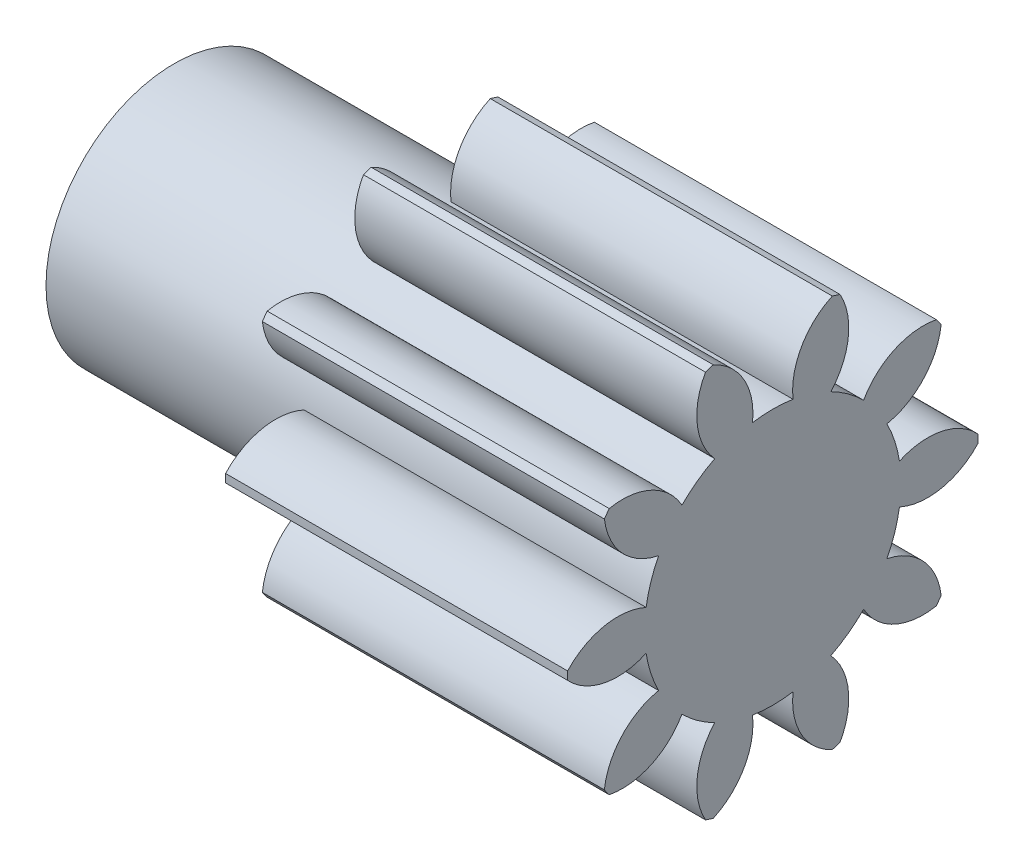
from build123d import *
from build123d.topology import SkipClean

# Parameters (mm, degrees)
ISO_START                                 = 20.256289073
ISO_SPUR_GEAR_0_8M_10T_20PA_8FW_2_R       = 0.4
ISO_SPUR_GEAR_0_8M_10T_20PA_8FW_S10_DEPTH = 8
BOSS_EXTRUDE1_DEPTH                       = 6
BOSS_EXTRUDE1_DEPTH_BACK                  = 8
SKETCH1_R                                 = 2.999
SKETCH2_R                                 = 2.4
CUT_EXTRUDE1_DEPTH                        = 3.2


# Read off the part's stored shape, not the designer's step: ISO - Spur gear 0.8M 10T 20PA 8FW ---S10A75H50L0.8N
with BuildPart() as part:
    # ISO - Spur gear 0.8M 10T 20PA 8FW -- 2 → ISO - Spur gear 0.8M 10T 20PA 8FW ---S10 (new body)
    with BuildSketch(Plane.YZ.offset(ISO_START)):
        with BuildLine():
            ThreePointArc((-8.829245422, -9.554744908), (-8.733282752, -9.555704257), (-8.637320082, -9.554744908))
            ThreePointArc((-8.637320082, -9.554744908), (-8.156276182, -8.696191622), (-8.268716011, -7.718503397))
            ThreePointArc((-8.268716011, -7.718503397), (-7.806540786, -7.60792275), (-7.367635501, -7.425724592))
            ThreePointArc((-7.367635501, -7.425724592), (-6.883930514, -8.282781454), (-5.990112863, -8.694615143))
            ThreePointArc((-5.990112863, -8.694615143), (-5.911913541, -8.63898583), (-5.834842001, -8.581804258))
            ThreePointArc((-5.834842001, -8.581804258), (-5.950314271, -7.604469549), (-6.615950723, -6.879593633))
            ThreePointArc((-6.615950723, -6.879593633), (-6.307040786, -6.518472229), (-6.059052342, -6.113088769))
            ThreePointArc((-6.059052342, -6.113088769), (-5.163961403, -6.522147678), (-4.198777965, -6.329955298))
            ThreePointArc((-4.198777965, -6.329955298), (-4.168211474, -6.23898583), (-4.139469773, -6.147423452))
            ThreePointArc((-4.139469773, -6.147423452), (-4.807351731, -5.42461596), (-5.771934306, -5.229430316))
            ThreePointArc((-5.771934306, -5.229430316), (-5.734282752, -4.755704258), (-5.771934306, -4.281978199))
            ThreePointArc((-5.771934306, -4.281978199), (-4.807351731, -4.086792554), (-4.139469773, -3.363985063))
            ThreePointArc((-4.139469773, -3.363985063), (-4.168211474, -3.272422685), (-4.198777965, -3.181453217))
            ThreePointArc((-4.198777965, -3.181453217), (-5.163961403, -2.989260837), (-6.059052342, -3.398319746))
            ThreePointArc((-6.059052342, -3.398319746), (-6.307040786, -2.992936286), (-6.615950723, -2.631814882))
            ThreePointArc((-6.615950723, -2.631814882), (-5.950314271, -1.906938966), (-5.834842001, -0.929604257))
            ThreePointArc((-5.834842001, -0.929604257), (-5.91191354, -0.872422684), (-5.990112863, -0.816793372))
            ThreePointArc((-5.990112863, -0.816793372), (-6.883930514, -1.228627061), (-7.367635501, -2.085683923))
            ThreePointArc((-7.367635501, -2.085683923), (-7.806540786, -1.903485765), (-8.268716011, -1.792905118))
            ThreePointArc((-8.268716011, -1.792905118), (-8.156276182, -0.815216893), (-8.637320082, 0.043336393))
            ThreePointArc((-8.637320082, 0.043336393), (-8.733282752, 0.044295743), (-8.829245422, 0.043336393))
            ThreePointArc((-8.829245422, 0.043336393), (-9.310289322, -0.815216893), (-9.197849493, -1.792905118))
            ThreePointArc((-9.197849493, -1.792905118), (-9.660024718, -1.903485765), (-10.098930003, -2.085683923))
            ThreePointArc((-10.098930003, -2.085683923), (-10.58263499, -1.228627061), (-11.476452641, -0.816793372))
            ThreePointArc((-11.476452641, -0.816793372), (-11.554651964, -0.872422684), (-11.631723503, -0.929604257))
            ThreePointArc((-11.631723503, -0.929604257), (-11.516251233, -1.906938966), (-10.850614781, -2.631814882))
            ThreePointArc((-10.850614781, -2.631814882), (-11.159524718, -2.992936286), (-11.407513162, -3.398319746))
            ThreePointArc((-11.407513162, -3.398319746), (-12.302604101, -2.989260837), (-13.267787539, -3.181453217))
            ThreePointArc((-13.267787539, -3.181453217), (-13.29835403, -3.272422685), (-13.327095731, -3.363985063))
            ThreePointArc((-13.327095731, -3.363985063), (-12.659213773, -4.086792554), (-11.694631199, -4.281978199))
            ThreePointArc((-11.694631199, -4.281978199), (-11.732282752, -4.755704258), (-11.694631199, -5.229430316))
            ThreePointArc((-11.694631199, -5.229430316), (-12.659213774, -5.42461596), (-13.327095731, -6.147423452))
            ThreePointArc((-13.327095731, -6.147423452), (-13.29835403, -6.23898583), (-13.267787539, -6.329955298))
            ThreePointArc((-13.267787539, -6.329955298), (-12.302604101, -6.522147678), (-11.407513162, -6.113088769))
            ThreePointArc((-11.407513162, -6.113088769), (-11.159524718, -6.518472229), (-10.850614781, -6.879593633))
            ThreePointArc((-10.850614781, -6.879593633), (-11.516251233, -7.604469549), (-11.631723503, -8.581804258))
            ThreePointArc((-11.631723503, -8.581804258), (-11.554651963, -8.63898583), (-11.476452641, -8.694615143))
            ThreePointArc((-11.476452641, -8.694615143), (-10.58263499, -8.282781454), (-10.098930003, -7.425724592))
            ThreePointArc((-10.098930003, -7.425724592), (-9.660024718, -7.60792275), (-9.197849493, -7.718503397))
            ThreePointArc((-9.197849493, -7.718503397), (-9.310289322, -8.696191622), (-8.829245422, -9.554744908))
        make_face()
        with Locations((-8.733282752, -4.755704257)):
            Circle(ISO_SPUR_GEAR_0_8M_10T_20PA_8FW_2_R, mode=Mode.SUBTRACT)
    extrude(amount=ISO_SPUR_GEAR_0_8M_10T_20PA_8FW_S10_DEPTH)

    # Sketch1 → Boss-Extrude1 (add, two sides: drawn at the far end of the back side and taken through both)
    with SkipClean():  # the faces are left unmerged after this step: merging them gives an invalid solid
        with BuildSketch(Plane.ZY.offset(-20.256289073).offset(-BOSS_EXTRUDE1_DEPTH_BACK)):
            with Locations((-4.755704257, -8.733282752)):
                Circle(SKETCH1_R)
        extrude(amount=BOSS_EXTRUDE1_DEPTH + BOSS_EXTRUDE1_DEPTH_BACK)

    # Sketch2 → Cut-Extrude1 (cut)
    with SkipClean():  # the faces are left unmerged after this step: merging them gives an invalid solid
        with BuildSketch(Plane.ZY.offset(-14.256289073)):
            with Locations((-4.755704257, -8.733282752)):
                Circle(SKETCH2_R)
        extrude(amount=-CUT_EXTRUDE1_DEPTH, mode=Mode.SUBTRACT)


solid = part.part
